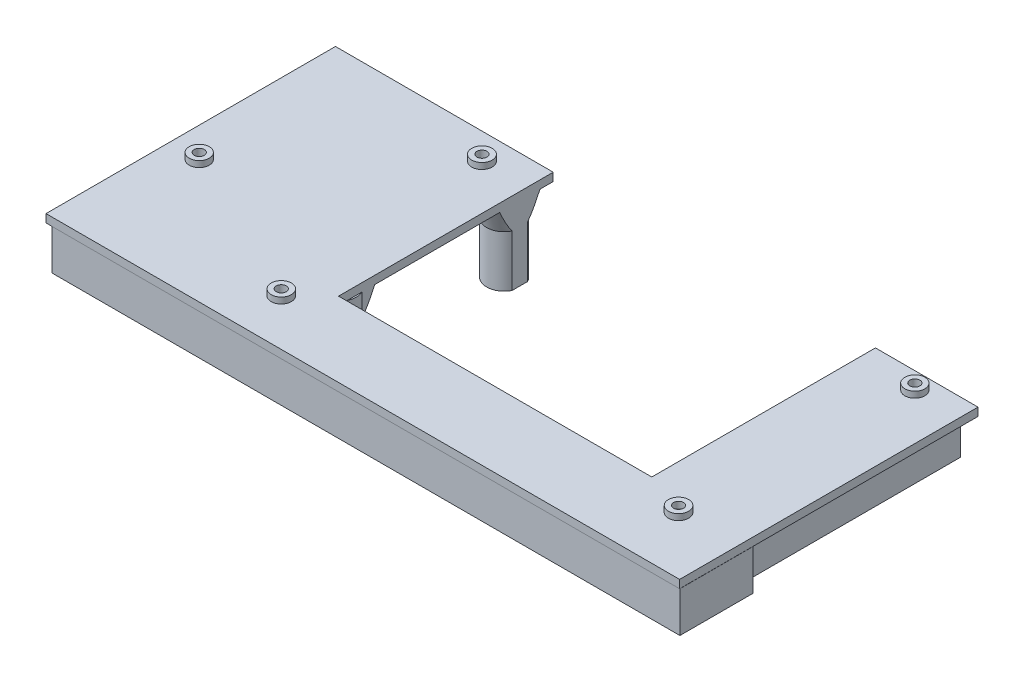
from build123d import *

# Parameters (mm, degrees)
SKETCH1_W                 = 25.299499494
SKETCH1_H                 = 55.159009877
SKETCH1_R                 = 1.241657959
SKETCH1_R_2               = 1.244649804
SKETCH1_R_3               = 1.243452392
SKETCH1_W_2               = 53.713568487
SKETCH1_H_2               = 52.951897156
SKETCH1_R_4               = 1.244762628
SKETCH1_R_5               = 1.240228495
BOSS_EXTRUDE1_DEPTH       = 2
SKETCH2_R                 = 2.521764251
SKETCH2_R_2               = 1.240228495
SKETCH2_R_3               = 2.471513498
SKETCH2_R_4               = 1.244762628
SKETCH2_R_5               = 2.485581318
SKETCH2_R_6               = 1.244649804
SKETCH2_R_7               = 2.50000008
SKETCH2_R_8               = 1.232345201
SKETCH2_R_9               = 2.472424153
SKETCH2_R_10              = 1.241657959
BOSS_EXTRUDE2_DEPTH       = 1.5
BOSS_EXTRUDE3_OUTLINE_R   = 4.264975471
BOSS_EXTRUDE3_OUTLINE_R_2 = 1.25
BOSS_EXTRUDE3_OUTLINE_R_3 = 4.293360572
BOSS_EXTRUDE3_DEPTH       = 18.2
BOSS_EXTRUDE4_OUTLINE_W   = 148.81215391
BOSS_EXTRUDE4_OUTLINE_H   = 14.000040224
BOSS_EXTRUDE4_DEPTH       = 10
SKETCH7_W                 = 18.030681689
SKETCH7_H                 = 1.47954917
BOSS_EXTRUDE5_DEPTH       = 10
SKETCH8_R                 = 2.5
SKETCH8_W                 = 14.030681689
SKETCH8_H                 = 1
CUT_EXTRUDE1_DEPTH        = 16.42
SKETCH9_W                 = 2
SKETCH9_H                 = 18.000040224
BOSS_EXTRUDE6_DEPTH       = 10
SKETCH10_W                = 1
SKETCH10_H                = 14.000040224
SKETCH10_W_2              = 1.5
SKETCH10_H_2              = 5
CUT_EXTRUDE2_DEPTH        = 10
CHAMFER1_SIZE             = 2
CHAMFER1_SIZE_2           = 5.494954839
SKETCH12_W                = 15.030681689
SKETCH12_H                = 50.706334577
SKETCH12_W_2              = 14.030681689
SKETCH12_H_2              = 49.706334577
SKETCH12_W_3              = 149.81215391
SKETCH12_H_3              = 15.000040224
SKETCH12_W_4              = 148.81215391
SKETCH12_H_4              = 14.000040224
CUT_EXTRUDE3_DEPTH        = 16.42
SKETCH13_R                = 17.983803221
BOSS_EXTRUDE7_DEPTH       = 2


# Read off the part's stored shape, not the designer's step: Boss-Extrude3, Boss-Extrude4
with BuildPart() as part:
    # Sketch1 → Boss-Extrude1 (new body)
    # profile 1 of 3: a face of its own
    with BuildSketch(Plane(origin=(0, 0, 0), x_dir=(1, 0, 0), z_dir=(0, 1, 0))):
        with Locations((-12.099843009, -21.166171701)):
            Rectangle(SKETCH1_W, SKETCH1_H)
        with Locations(Location((-10.884458073, 2.271979315, 0), (0, 0, 270))):
            Circle(SKETCH1_R, mode=Mode.SUBTRACT)
    # profile 2 of 3: a face of its own
    with BuildSketch(Plane(origin=(0, 0, 0), x_dir=(1, 0, 0), z_dir=(0, 1, 0))):
        Polygon((0.549906738, -67.187297417), (0.549906738, -48.745676639), (-24.749592756, -48.745676639), (-102.011751733, -48.745676639), (-155.72532022, -48.745676639), (-155.72532022, -67.187297417), align=None)
        with Locations(Location((-109.139310681, -55.741320352, 0), (0, 0, 270))):
            Circle(SKETCH1_R_2, mode=Mode.SUBTRACT)
        with Locations(Location((-13.892677204, -53.014877456, 0), (0, 0, 270))):
            Circle(SKETCH1_R_3, mode=Mode.SUBTRACT)
    # profile 3 of 3: a face of its own
    with BuildSketch(Plane(origin=(0, 0, 0), x_dir=(1, 0, 0), z_dir=(0, 1, 0))):
        with Locations((-128.868535977, -22.269728061)):
            Rectangle(SKETCH1_W_2, SKETCH1_H_2)
        with Locations(Location((-148.388511799, -36.727074265, 0), (0, 0, 270))):
            Circle(SKETCH1_R_4, mode=Mode.SUBTRACT)
        with Locations(Location((-113.148248588, -2.237044718, 0), (0, 0, 270))):
            Circle(SKETCH1_R_5, mode=Mode.SUBTRACT)
    extrude(amount=BOSS_EXTRUDE1_DEPTH)

    # Sketch2 → Boss-Extrude2 (add)
    # profile 1 of 5: a face of its own
    with BuildSketch(Plane(origin=(0, 2, 0), x_dir=(1, 0, 0), z_dir=(0, 1, 0))):
        with Locations(Location((-113.148248588, -2.237044718, 0), (0, 0, 270))):
            Circle(SKETCH2_R)
        with Locations(Location((-113.148248588, -2.237044718, 0), (0, 0, 270))):
            Circle(SKETCH2_R_2, mode=Mode.SUBTRACT)
    # profile 2 of 5: a face of its own
    with BuildSketch(Plane(origin=(0, 2, 0), x_dir=(1, 0, 0), z_dir=(0, 1, 0))):
        with Locations(Location((-148.388511799, -36.727074265, 0), (0, 0, 270))):
            Circle(SKETCH2_R_3)
        with Locations(Location((-148.388511799, -36.727074265, 0), (0, 0, 270))):
            Circle(SKETCH2_R_4, mode=Mode.SUBTRACT)
    # profile 3 of 5: a face of its own
    with BuildSketch(Plane(origin=(0, 2, 0), x_dir=(1, 0, 0), z_dir=(0, 1, 0))):
        with Locations(Location((-109.139310681, -55.741320352, 0), (0, 0, 270))):
            Circle(SKETCH2_R_5)
        with Locations(Location((-109.139310681, -55.741320352, 0), (0, 0, 270))):
            Circle(SKETCH2_R_6, mode=Mode.SUBTRACT)
    # profile 4 of 5: a face of its own
    with BuildSketch(Plane(origin=(0, 2, 0), x_dir=(1, 0, 0), z_dir=(0, 1, 0))):
        with Locations(Location((-13.886720738, -53.00550248, 0), (0, 0, 270))):
            Circle(SKETCH2_R_7)
        with Locations(Location((-13.886720738, -53.00550248, 0), (0, 0, 57.569834669))):
            Circle(SKETCH2_R_8, mode=Mode.SUBTRACT)
    # profile 5 of 5: a face of its own
    with BuildSketch(Plane(origin=(0, 2, 0), x_dir=(1, 0, 0), z_dir=(0, 1, 0))):
        with Locations(Location((-10.884458073, 2.271979315, 0), (0, 0, 270))):
            Circle(SKETCH2_R_9)
        with Locations(Location((-10.884458073, 2.271979315, 0), (0, 0, 270))):
            Circle(SKETCH2_R_10, mode=Mode.SUBTRACT)
    extrude(amount=BOSS_EXTRUDE2_DEPTH)

    # Boss-Extrude3 outline → Boss-Extrude3 (add)
    # profile 1 of 4: a face of its own
    with BuildSketch(Plane.XZ):
        with Locations((-105.874082677, 44.738348581)):
            Circle(BOSS_EXTRUDE3_OUTLINE_R)
        with Locations((-105.874082677, 44.738348581)):
            Circle(BOSS_EXTRUDE3_OUTLINE_R_2, mode=Mode.SUBTRACT)
    # profile 2 of 4: a face of its own
    with BuildSketch(Plane.XZ):
        with BuildLine():
            ThreePointArc((-102.011751733, 5.914823562), (-110.167443249, 4.039898313), (-102.011751733, 2.164973064))
            Line((-102.011751733, 2.164973064), (-102.011751733, 5.914823562))
        make_face()
        with Locations((-105.874082677, 4.039898313)):
            Circle(BOSS_EXTRUDE3_OUTLINE_R_2, mode=Mode.SUBTRACT)
    # profile 3 of 4: a face of its own
    with BuildSketch(Plane.XZ):
        with Locations((-146.574082677, 4.039898313)):
            Circle(BOSS_EXTRUDE3_OUTLINE_R_3)
        with Locations((-146.574082677, 4.039898313)):
            Circle(BOSS_EXTRUDE3_OUTLINE_R_2, mode=Mode.SUBTRACT)
    # profile 4 of 4: a face of its own
    with BuildSketch(Plane.XZ):
        with Locations((-146.574082677, 44.738348581)):
            Circle(BOSS_EXTRUDE3_OUTLINE_R)
        with Locations((-146.574082677, 44.738348581)):
            Circle(BOSS_EXTRUDE3_OUTLINE_R_2, mode=Mode.SUBTRACT)
    extrude(amount=BOSS_EXTRUDE3_DEPTH)

    # Boss-Extrude4 outline → Boss-Extrude4 (add)
    with BuildSketch(Plane.XZ):
        Polygon((-2.890953027, -4.07972047), (-2.890953027, 49.144078772), (-1.415765517, 49.144078772), (-1.415765517, 67.144118996), (-154.227919427, 67.144118996), (-154.227919427, 49.144078772), (-20.921634716, 49.144078772), (-20.921634716, -4.07972047), align=None)
        with BuildLine():
            ThreePointArc((-9.657775138, -2.07972047), (-10.884458073, -3.513637274), (-12.111141008, -2.07972047))
            Line((-12.111141008, -2.07972047), (-18.921634716, -2.07972047))
            Line((-18.921634716, -2.07972047), (-18.921634716, 47.626614107))
            Line((-18.921634716, 47.626614107), (-4.890953027, 47.626614107))
            Line((-4.890953027, 47.626614107), (-4.890953027, -2.07972047))
            Line((-4.890953027, -2.07972047), (-9.657775138, -2.07972047))
        make_face(mode=Mode.SUBTRACT)
        with Locations((-77.821842472, 58.144098884)):
            Rectangle(BOSS_EXTRUDE4_OUTLINE_W, BOSS_EXTRUDE4_OUTLINE_H, mode=Mode.SUBTRACT)
    extrude(amount=BOSS_EXTRUDE4_DEPTH)

    # Sketch7 → Boss-Extrude5 (add)
    with BuildSketch(Plane.XZ):
        with Locations((-11.906293872, -4.819495055)):
            Rectangle(SKETCH7_W, SKETCH7_H)
    extrude(amount=BOSS_EXTRUDE5_DEPTH)

    # Sketch8 → Cut-Extrude1 (cut)
    with BuildSketch(Plane.XZ):
        with Locations((-10.884458073, -2.271979315)):
            Circle(SKETCH8_R)
        with Locations((-11.906293872, -4.07972047)):
            Rectangle(SKETCH8_W, SKETCH8_H)
    extrude(amount=CUT_EXTRUDE1_DEPTH, mode=Mode.SUBTRACT)

    # Sketch9 → Boss-Extrude6 (add)
    with BuildSketch(Plane.XZ):
        with Locations((-0.415765517, 58.144098884)):
            Rectangle(SKETCH9_W, SKETCH9_H)
    extrude(amount=BOSS_EXTRUDE6_DEPTH)

    # Sketch10 → Cut-Extrude2 (cut)
    with BuildSketch(Plane.XZ.offset(10)):
        with Locations((-1.415765517, 58.144098884)):
            Rectangle(SKETCH10_W, SKETCH10_H)
        with Locations((-2.665765517, 58.144118996)):
            Rectangle(SKETCH10_W_2, SKETCH10_H_2)
    extrude(amount=-CUT_EXTRUDE2_DEPTH, mode=Mode.SUBTRACT)

    # Chamfer1
    # the kernel refuses this chamfer: 5.494954839, 2 mm, written as the material it adds along each edge
    with BuildSketch(Plane(origin=(-105.874082677, 0, 44.738348581), x_dir=(0.9999950652018582, 0, 0.0031415874859127522), z_dir=(0.0031415874859127522, 0, -0.9999950652018582))) as chamfer1_piece_1_section:
        Polygon((4.264975471 + CHAMFER1_SIZE, 0), (4.264975471, CHAMFER1_SIZE_2), (4.264975471, 0), align=None)
    chamfer1_piece_1 = revolve(axis=Axis((-105.874082677, 0, 44.738348581), (0, -1, 0)), revolution_arc=359.64, mode=Mode.PRIVATE)
    chamfer1_piece_1 = split(chamfer1_piece_1, bisect_by=Plane(origin=(-102.011751733, -2.257712416, 48.069640288), z_dir=(-1, 0, 0)), keep=Keep.TOP, mode=Mode.PRIVATE)
    add(chamfer1_piece_1)
    with BuildSketch(Plane(origin=(-105.874082677, 0, 44.738348581), x_dir=(0.9999950652018582, 0, 0.0031415874859127522), z_dir=(0.0031415874859127522, 0, -0.9999950652018582))) as chamfer1_piece_2_section:
        Polygon((4.264975471 + CHAMFER1_SIZE, 0), (4.264975471, CHAMFER1_SIZE_2), (4.264975471, 0), align=None)
    chamfer1_piece_2 = revolve(axis=Axis((-105.874082677, 0, 44.738348581), (0, -1, 0)), revolution_arc=359.64, mode=Mode.PRIVATE)
    chamfer1_piece_2 = split(chamfer1_piece_2, bisect_by=Plane(origin=(-101.74069423, -0.533251507, 48.745676639), z_dir=(0, 0, 1)), keep=Keep.TOP, mode=Mode.PRIVATE)
    add(chamfer1_piece_2)
    with BuildSketch(Plane(origin=(-105.874082676, 0, 4.039898313), x_dir=(0.9999950652018581, 0, 0.0031415874858793983), z_dir=(0.0031415874858793983, 0, -0.9999950652018581))) as chamfer1_piece_3_section:
        Polygon((4.293360573 + CHAMFER1_SIZE, 0), (4.293360573, CHAMFER1_SIZE_2), (4.293360573, 0), align=None)
    chamfer1_piece_3 = revolve(axis=Axis((-105.874082676, 0, 4.039898313), (0, -1, 0)), revolution_arc=359.64, mode=Mode.PRIVATE)
    chamfer1_piece_3 = split(chamfer1_piece_3, bisect_by=Plane(origin=(-102.011751733, -2.729942782, 4.039898313), z_dir=(-1, 0, 0)), keep=Keep.TOP, mode=Mode.PRIVATE)
    chamfer1_piece_3 = chamfer1_piece_3 - Plane(origin=(-113.148248588, -2.729942782, 2.237044718), x_dir=(0, 0, 1), z_dir=(0, -1, 0)) * Cylinder(1.240228495, 26, mode=Mode.PRIVATE)
    add(chamfer1_piece_3)
    with BuildSketch(Plane(origin=(-146.574082677, 0, 4.039898313), x_dir=(1, 0, 0), z_dir=(0, 0, -1))) as chamfer1_piece_4:
        Polygon((4.293360572 + CHAMFER1_SIZE, 0), (4.293360572, CHAMFER1_SIZE_2), (4.293360572, 0), align=None)
    revolve(axis=Axis((-146.574082677, 0, 4.039898313), (0, -1, 0)))
    with BuildSketch(Plane(origin=(-146.574082677, 0, 44.738348581), x_dir=(1, 0, 0), z_dir=(0, 0, -1))) as chamfer1_piece_5:
        Polygon((4.264975471 + CHAMFER1_SIZE, 0), (4.264975471, CHAMFER1_SIZE_2), (4.264975471, 0), align=None)
    revolve(axis=Axis((-146.574082677, 0, 44.738348581), (0, -1, 0)))

    # Sketch12 → Cut-Extrude3 (cut)
    # profile 1 of 2: a face of its own
    with BuildSketch(Plane.XZ):
        with Locations((-11.906293872, 22.773446819)):
            Rectangle(SKETCH12_W, SKETCH12_H)
        with Locations((-11.906293872, 22.773446819)):
            Rectangle(SKETCH12_W_2, SKETCH12_H_2, mode=Mode.SUBTRACT)
    # profile 2 of 2: a face of its own
    with BuildSketch(Plane.XZ):
        with Locations((-77.821842472, 58.144098884)):
            Rectangle(SKETCH12_W_3, SKETCH12_H_3)
        with Locations((-77.821842472, 58.144098884)):
            Rectangle(SKETCH12_W_4, SKETCH12_H_4, mode=Mode.SUBTRACT)
    extrude(amount=CUT_EXTRUDE3_DEPTH, mode=Mode.SUBTRACT)

    # Sketch13 → Boss-Extrude7 (add)
    with BuildSketch(Plane(origin=(0, 0, 0), x_dir=(-1, 0, 0), z_dir=(0, -1, 0))):
        with Locations(Location((127.431607473, -24.759221512, 0), (0, 0, 270))):
            Circle(SKETCH13_R)
    extrude(amount=BOSS_EXTRUDE7_DEPTH)


solid = part.part
